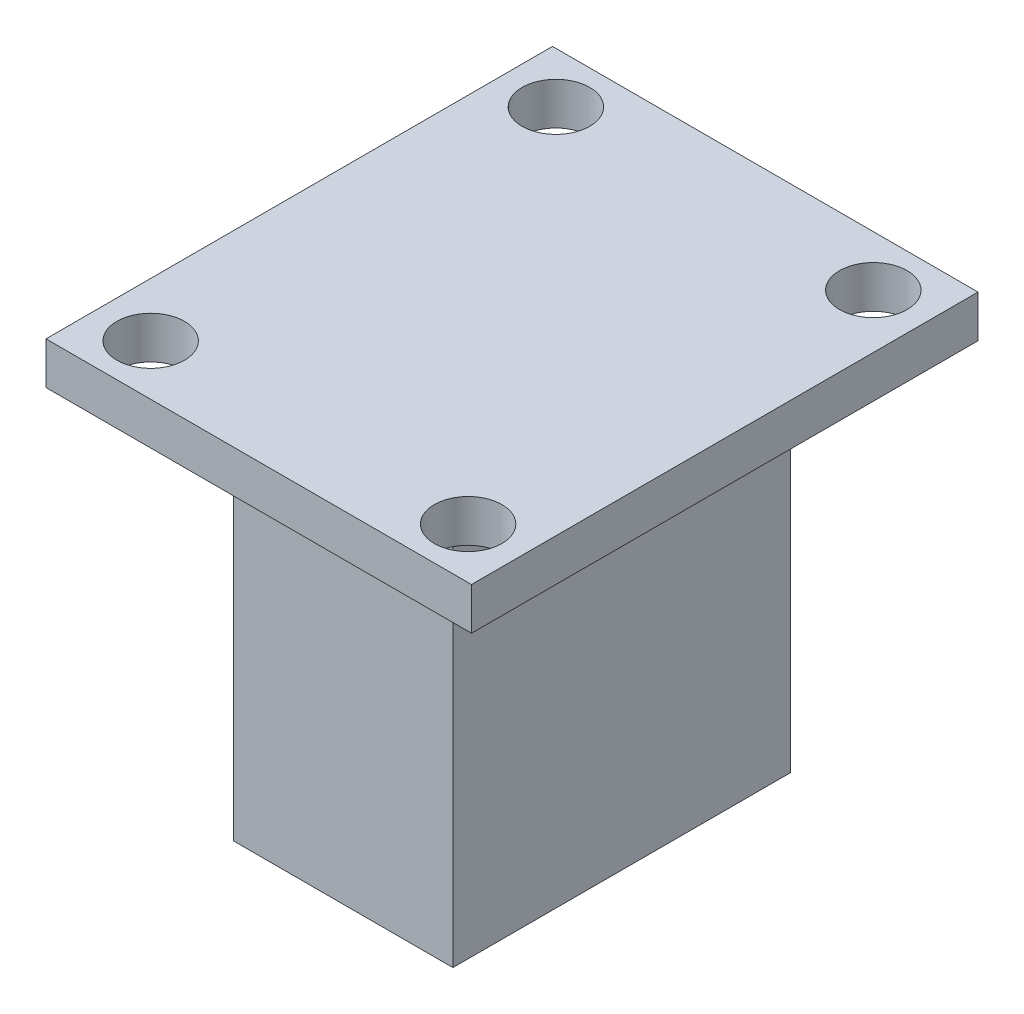
from build123d import *

# Parameters (mm, degrees)
SKETCH3_W           = 32.004
SKETCH3_H           = 38.1
BOSS_EXTRUDE1_DEPTH = 3.175
SKETCH4_R           = 2.54
SCREW_HOLES_DEPTH   = 26.080811969
SKETCH5_W           = 16.51
SKETCH5_H           = 25.4
WHEEL_APPROX_DEPTH  = 32.004


with BuildPart() as part:
    # Sketch3 → Boss-Extrude1 (new body)
    with BuildSketch(Plane(origin=(0, 0, 0), x_dir=(1, 0, 0), z_dir=(0, 1, 0))):
        Rectangle(SKETCH3_W, SKETCH3_H)
    extrude(amount=-BOSS_EXTRUDE1_DEPTH)

    # Sketch4 → Screw Holes (cut, through all)
    with BuildSketch(Plane(origin=(0, 0, 0), x_dir=(1, 0, 0), z_dir=(0, 1, 0))):
        with Locations((11.938, 15.24)):
            Circle(SKETCH4_R)
        with Locations((-11.938, 15.24)):
            Circle(SKETCH4_R)
        with Locations((-11.938, -15.24)):
            Circle(SKETCH4_R)
        with Locations((11.938, -15.24)):
            Circle(SKETCH4_R)
    extrude(amount=-SCREW_HOLES_DEPTH, mode=Mode.SUBTRACT)

    # Sketch5 → Wheel Approx (add)
    with BuildSketch(Plane(origin=(0, 0, 0), x_dir=(1, 0, 0), z_dir=(0, 1, 0))):
        Rectangle(SKETCH5_W, SKETCH5_H)
    extrude(amount=-WHEEL_APPROX_DEPTH)


solid = part.part
